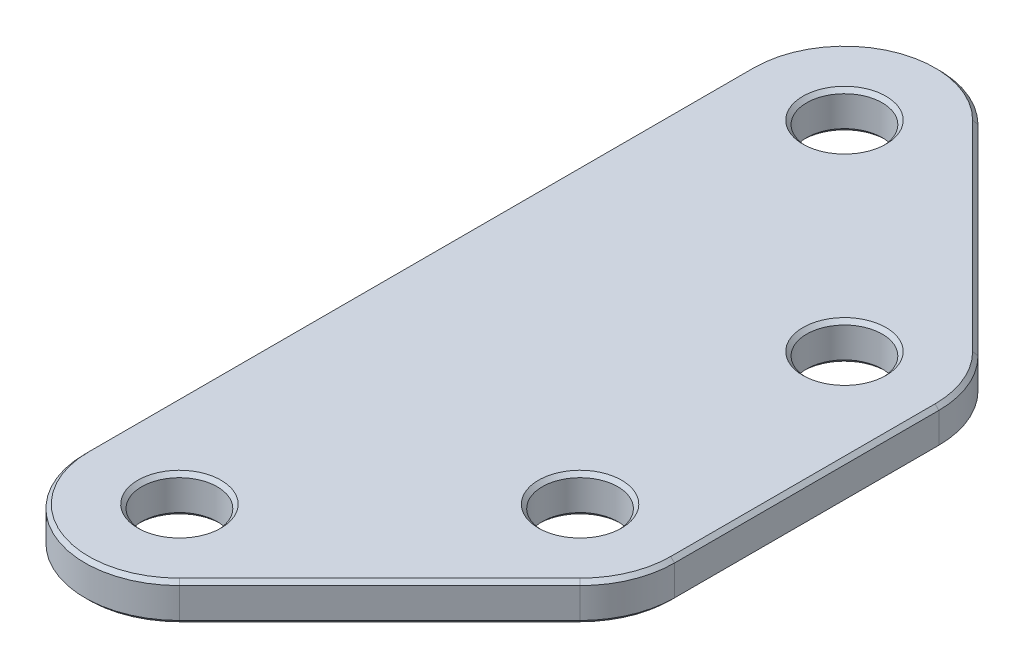
from build123d import *

# Parameters (mm, degrees)
SKETCH1_R           = 20
BOSS_EXTRUDE1_DEPTH = 20
CHAMFER1_SIZE       = 2


with BuildPart() as part:
    # Sketch1 → Boss-Extrude1 (new body)
    with BuildSketch(Plane(origin=(0, 0, 0), x_dir=(1, 0, 0), z_dir=(0, 1, 0))):
        with BuildLine():
            Line((-100, 176.066017178), (-100, -176.066017178))
            ThreePointArc((-100, -176.066017178), (-69.134171618, -222.259993804), (-14.644660941, -211.421356237))
            Line((-14.644660941, -211.421356237), (91.421356237, -105.355339059))
            ThreePointArc((91.421356237, -105.355339059), (102.259993804, -89.134171618), (106.066017178, -70))
            Line((106.066017178, -70), (106.066017178, 70))
            ThreePointArc((106.066017178, 70), (102.259993804, 89.134171618), (91.421356237, 105.355339059))
            Line((91.421356237, 105.355339059), (-14.644660941, 211.421356237))
            ThreePointArc((-14.644660941, 211.421356237), (-69.134171618, 222.259993804), (-100, 176.066017178))
        make_face()
        with Locations((-50, 176.066017178)):
            Circle(SKETCH1_R, mode=Mode.SUBTRACT)
        with Locations((56.066017178, 70)):
            Circle(SKETCH1_R, mode=Mode.SUBTRACT)
        with Locations((56.066017178, -70)):
            Circle(SKETCH1_R, mode=Mode.SUBTRACT)
        with Locations((-50, -176.066017178)):
            Circle(SKETCH1_R, mode=Mode.SUBTRACT)
    extrude(amount=BOSS_EXTRUDE1_DEPTH)

    # Chamfer1
    chamfer1_edges = [part.edges().sort_by_distance(p)[0] for p in [
        (36.066017178, 0, -70),
        (36.066017178, 20, -70),
        (-70, 0, 176.066017178),
        (-70, 20, 176.066017178),
        (36.066017178, 0, 70),
        (36.066017178, 20, 70),
        (-70, 0, -176.066017178),
        (-70, 20, -176.066017178),
        (38.388347648, 0, 158.388347648),
        (102.259993804, 0, 89.134171618),
        (106.066017178, 0, 0),
        (102.259993804, 0, -89.134171618),
        (38.388347648, 0, -158.388347648),
        (-69.134171618, 0, -222.259993804),
        (-100, 0, 0),
        (-69.134171618, 0, 222.259993804),
        (-100, 20, 0),
        (-69.134171618, 20, -222.259993804),
        (38.388347648, 20, -158.388347648),
        (102.259993804, 20, -89.134171618),
        (106.066017178, 20, 0),
        (102.259993804, 20, 89.134171618),
        (38.388347648, 20, 158.388347648),
        (-69.134171618, 20, 222.259993804),
    ]]
    chamfer(chamfer1_edges, length=CHAMFER1_SIZE)


solid = part.part
